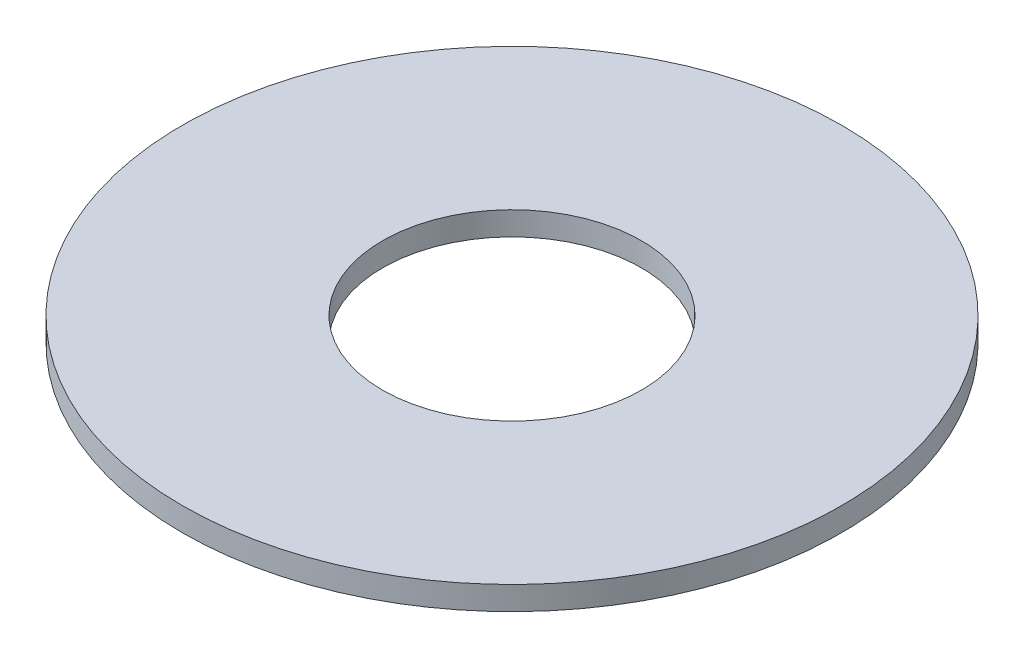
from build123d import *

# Parameters (mm, degrees)
SKETCH1_R           = 70
BOSS_EXTRUDE1_DEPTH = 5
SKETCH2_R           = 27.5
CUT_EXTRUDE1_DEPTH  = 100.121138008


with BuildPart() as part:
    # Sketch1 → Boss-Extrude1 (new body)
    with BuildSketch(Plane(origin=(0, 0, 0), x_dir=(1, 0, 0), z_dir=(0, 1, 0))):
        Circle(SKETCH1_R)
    extrude(amount=BOSS_EXTRUDE1_DEPTH)

    # Sketch2 → Cut-Extrude1 (cut, through all)
    with BuildSketch(Plane(origin=(0, 0, 0), x_dir=(1, 0, 0), z_dir=(0, 1, 0))):
        Circle(SKETCH2_R)
    extrude(amount=CUT_EXTRUDE1_DEPTH, mode=Mode.SUBTRACT)


solid = part.part
